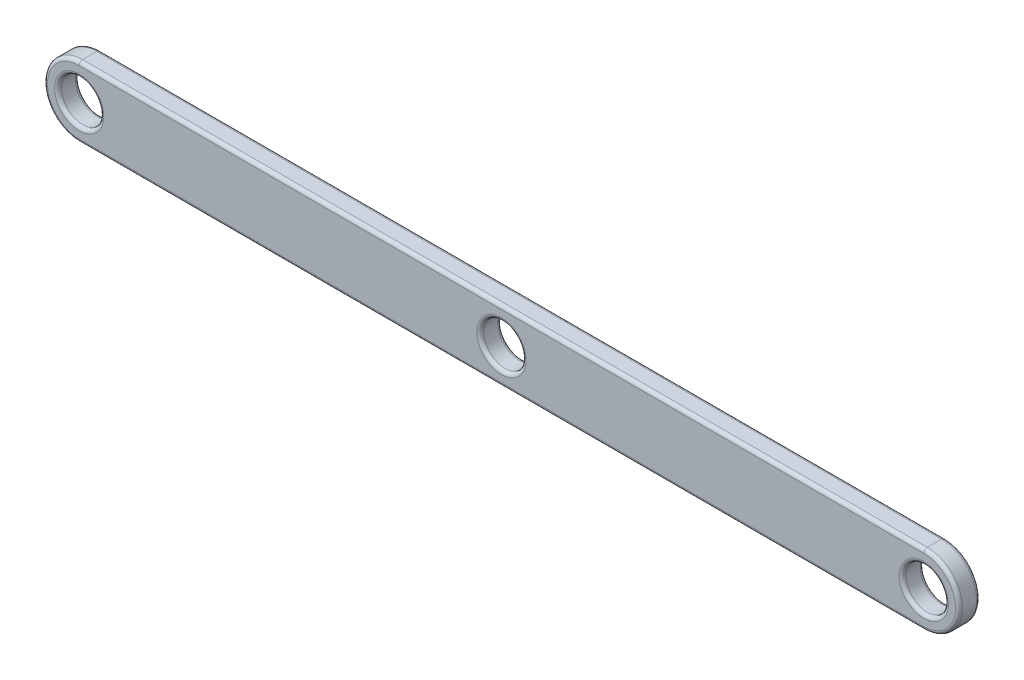
from build123d import *

# Parameters (mm, degrees)
SKETCH_1_R      = 3
EXTRUDE_1_DEPTH = 3
FILLET_1_R      = 0.5


with BuildPart() as part:
    # ｽｹｯﾁ1 → ﾎﾞｽ - 押し出し1 (new body)
    with BuildSketch(Plane.XY):
        with BuildLine():
            Line((0, 5), (120, 5))
            ThreePointArc((120, 5), (125, 0), (120, -5))
            Line((120, -5), (0, -5))
            ThreePointArc((0, -5), (-5, 0), (0, 5))
        make_face()
        with Locations((60, 0)):
            Circle(SKETCH_1_R, mode=Mode.SUBTRACT)
        with Locations((120, 0)):
            Circle(SKETCH_1_R, mode=Mode.SUBTRACT)
        Circle(SKETCH_1_R, mode=Mode.SUBTRACT)
    extrude(amount=EXTRUDE_1_DEPTH)

    # ﾌｨﾚｯﾄ1
    fillet_1_edges = [part.edges().sort_by_distance(p)[0] for p in [
        (-3, 0, 0),
        (57, 0, 0),
        (60, -5, 0),
        (125, 0, 0),
        (60, 5, 0),
        (-5, 0, 0),
        (117, 0, 0),
        (-3, 0, 3),
        (57, 0, 3),
        (60, 5, 3),
        (125, 0, 3),
        (60, -5, 3),
        (-5, 0, 3),
        (117, 0, 3),
    ]]
    fillet(fillet_1_edges, radius=FILLET_1_R)


solid = part.part
